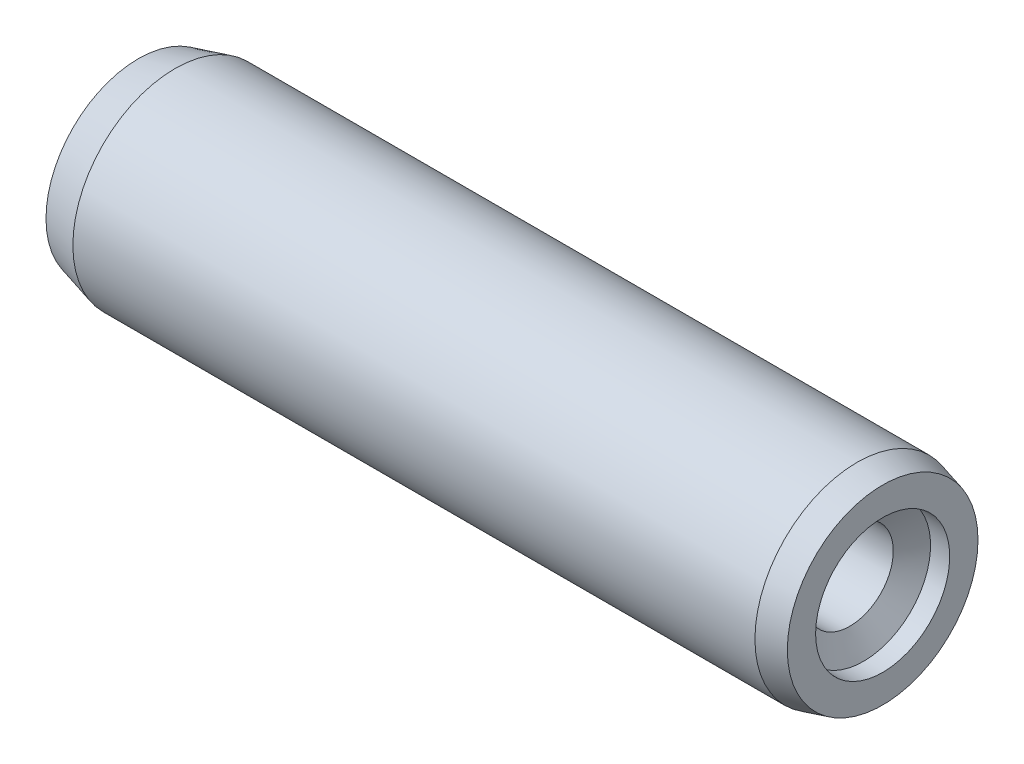
from build123d import *


with BuildPart() as part:
    # BodySke → Body (revolve)
    with BuildSketch(Plane.XY):
        with BuildLine():
            Line((4.6, 8), (58, 8))
            Line((58, 8), (60, 7.464101615))
            Line((60, 7.464101615), (60, 5.25))
            Line((60, 5.25), (58.5, 5.25))
            Line((58.5, 5.25), (57.431902002, 3.4))
            Line((57.431902002, 3.4), (35, 3.4))
            Line((35, 3.4), (33.591673888, 0))
            Line((33.591673888, 0), (0, 0))
            ThreePointArc((0, 0), (0.437676073, 3.716728939), (1.726759251, 7.230117462))
            Line((1.726759251, 7.230117462), (4.6, 8))
        make_face()
    revolve(axis=Axis((0, 0, 0), (1, 0, 0)))


solid = part.part
